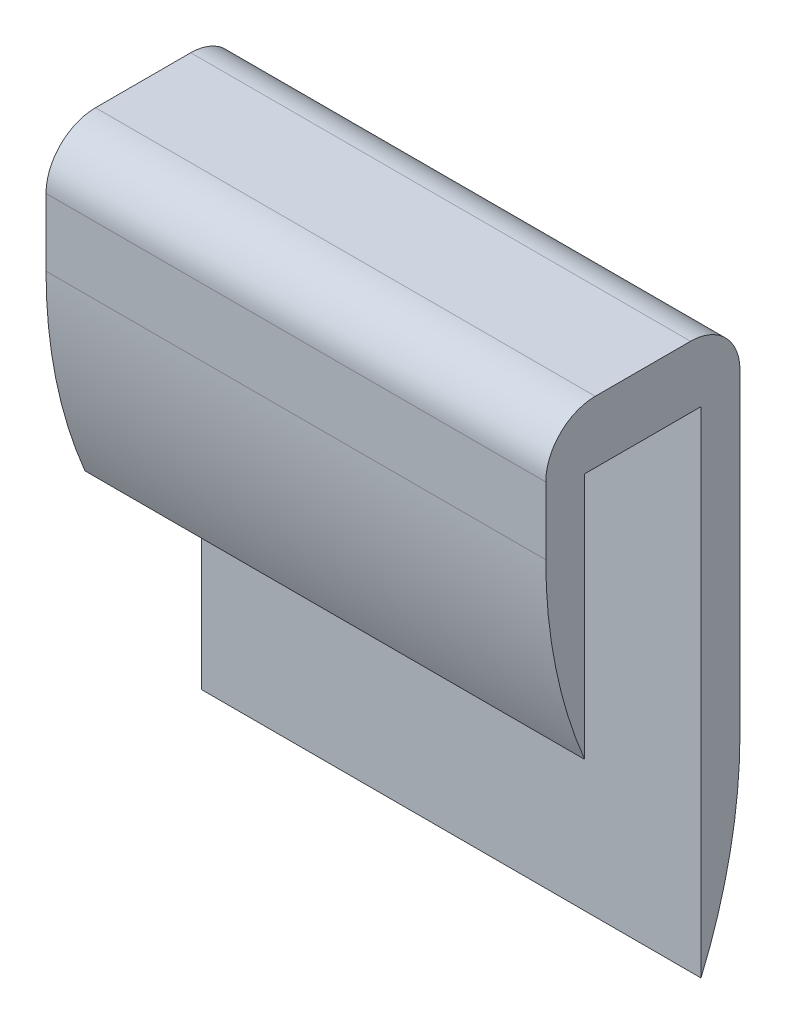
from build123d import *

# Parameters (mm, degrees)
BOSS_EXTRUDE1_DEPTH = 25.654
FILLET1_R           = 25.4
FILLET2_R           = 2.54


with BuildPart() as part:
    # Sketch1 → Boss-Extrude1 (new body)
    with BuildSketch(Plane(origin=(0, 0, 0), x_dir=(0, 0, -1), z_dir=(1, 0, 0))):
        Polygon((-4.9845, -12.7), (-2.9845, -12.7), (-2.9845, 0), (2.9845, 0), (2.9845, -25.4), (4.9845, -25.4), (4.9845, 3.175), (-4.9845, 3.175), align=None)
    extrude(amount=BOSS_EXTRUDE1_DEPTH)

    # Fillet1
    # the kernel refuses this fillet: 25.4 mm, written as the material it takes off along each edge
    with BuildSketch(Plane(origin=(-24.69817807, -12.7, 4.9845), x_dir=(0, 0, -1), z_dir=(1, 0, 0))) as fillet1_piece_1:
        with BuildLine():
            CenterArc((25.4, 9.879271228), FILLET1_R, 180, 22.889037196)
            Line((0, 9.879271228), (-0.508, 9.879271228))
            Line((-0.508, 9.879271228), (-0.508, 0))
            Line((-0.508, 0), (0, -0.508))
            ThreePointArc((0, -0.508), (1, -0.508), (1.532, -0.197585425))
            Line((1.532, -0.197585425), (2, 0))
        make_face()
    extrude(amount=75.050356141, mode=Mode.SUBTRACT)
    with BuildSketch(Plane(origin=(-24.69817807, -25.4, -4.9845), x_dir=(0, 0, 1), z_dir=(1, 0, 0))) as fillet1_piece_2:
        with BuildLine():
            CenterArc((25.4, -9.879271228), FILLET1_R, 157.110962804, 22.889037196)
            Line((0, -9.879271228), (-0.508, -9.879271228))
            Line((-0.508, -9.879271228), (-0.508, 0))
            Line((-0.508, 0), (0, 0.508))
            ThreePointArc((0, 0.508), (1, 0.508), (1.532, 0.197585425))
            Line((1.532, 0.197585425), (2, 0))
        make_face()
    extrude(amount=75.050356141, mode=Mode.SUBTRACT)

    # Fillet2
    fillet2_edges = [part.edges().sort_by_distance(p)[0] for p in [
        (12.827, 3.175, 4.9845),
        (12.827, 3.175, -4.9845),
    ]]
    fillet(fillet2_edges, radius=FILLET2_R)


solid = part.part
